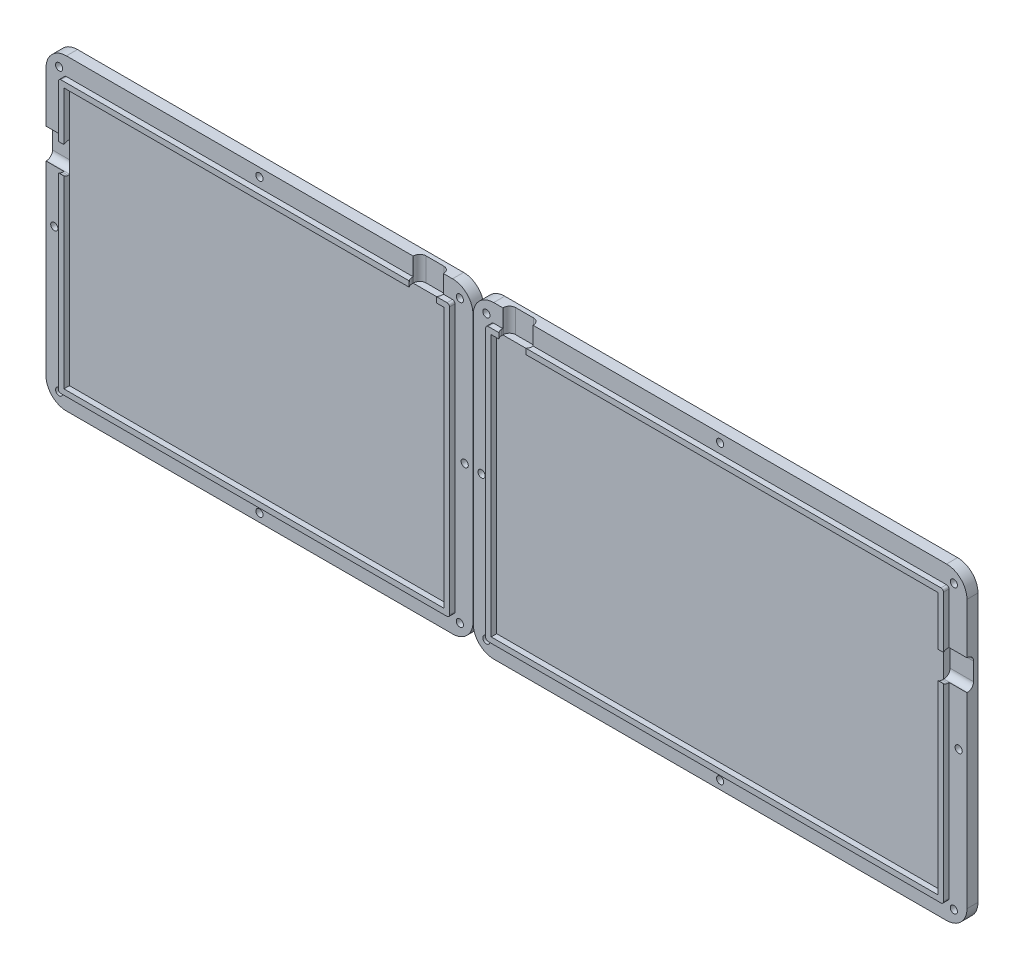
from build123d import *

# Parameters (mm, degrees)
BOSS_EXTRUDE1_DEPTH            = 2
BOSS_EXTRUDE1_2_DEPTH          = 2
BOSS_EXTRUDE2_DEPTH            = 4
BOSS_EXTRUDE2_2_DEPTH          = 4
CUT_EXTRUDE1_DEPTH             = 8.5
CUT_EXTRUDE2_START             = -8
CUT_EXTRUDE2_DEPTH             = 3.00475
CUT_EXTRUDE2_START_2           = -6.99525
CUT_EXTRUDE2_2_DEPTH           = 8.5
CUT_EXTRUDE3_START             = -7
CUT_EXTRUDE3_DEPTH             = 2
CUT_EXTRUDE3_START_2           = -24.24
CUT_EXTRUDE3_2_OUTLINE_W       = 2
CUT_EXTRUDE3_2_OUTLINE_H       = 2
CUT_EXTRUDE3_2_DEPTH           = 18.339999648
CUT_EXTRUDE3_START_3           = -2
CUT_EXTRUDE3_3_DEPTH           = 2
CUT_EXTRUDE3_START_4           = -14.39
CUT_EXTRUDE3_4_DEPTH           = 2
CUT_EXTRUDE3_START_5           = -24.799652403
CUT_EXTRUDE3_5_DEPTH           = 19.799652403
CUT_EXTRUDE3_6_DEPTH           = 2
CUT_EXTRUDE3_7_OUTLINE_W       = 2
CUT_EXTRUDE3_7_OUTLINE_H       = 2
CUT_EXTRUDE3_7_DEPTH           = 18.340003062
CUT_EXTRUDE3_8_DEPTH           = 2
CUT_EXTRUDE3_START_6           = 304.23
CUT_EXTRUDE3_9_DEPTH           = 2
CUT_EXTRUDE3_10_DEPTH          = 9
CUT_EXTRUDE3_11_DEPTH          = 19.799652403
CUT_EXTRUDE3_12_DEPTH          = 9
SKETCH7_R                      = 6
SKETCH7_R_2                    = 5.999999998
CUT_EXTRUDE4_DEPTH             = 1
CBORE_FOR_M2_SHCS1_AT_2_COUNT  = 2
CBORE_FOR_M2_SHCS1_AT_2_PITCH  = 169.33925
CBORE_FOR_M2_SHCS1_AT_3_COUNT  = 2
CBORE_FOR_M2_SHCS1_AT_3_PITCH  = 197.865862853
CBORE_FOR_M2_SHCS1_AT_4_COUNT  = 2
CBORE_FOR_M2_SHCS1_AT_4_PITCH  = 102.347999613
CBORE_FOR_M2_SHCS1_AT_5_COUNT  = 2
CBORE_FOR_M2_SHCS1_AT_5_PITCH  = 205.937809117
CBORE_FOR_M2_SHCS1_AT_6_COUNT  = 2
CBORE_FOR_M2_SHCS1_AT_6_PITCH  = 178.95
CBORE_FOR_M2_SHCS1_AT_7_COUNT  = 2
CBORE_FOR_M2_SHCS1_AT_7_PITCH  = 324.12
CBORE_FOR_M2_SHCS1_AT_8_COUNT  = 2
CBORE_FOR_M2_SHCS1_AT_8_PITCH  = 339.76617419
CBORE_FOR_M2_SHCS1_AT_9_COUNT  = 2
CBORE_FOR_M2_SHCS1_AT_9_PITCH  = 84.687729438
CBORE_FOR_M2_SHCS1_AT_10_COUNT = 2
CBORE_FOR_M2_SHCS1_AT_10_PITCH = 178.578567038
CBORE_FOR_M2_SHCS1_AT_11_COUNT = 2
CBORE_FOR_M2_SHCS1_AT_11_PITCH = 272.060490423
CBORE_FOR_M2_SHCS1_AT_12_COUNT = 2
CBORE_FOR_M2_SHCS1_AT_12_PITCH = 251.541084119
CBORE_FOR_M2_SHCS1_AT_13_COUNT = 2
CBORE_FOR_M2_SHCS1_AT_13_PITCH = 329.830375377
CBORE_FOR_M2_SHCS1_AT_14_COUNT = 2
CBORE_FOR_M2_SHCS1_AT_14_PITCH = 51.203914572
CBORE_FOR_M2_SHCS1_AT_15_COUNT = 2
CBORE_FOR_M2_SHCS1_AT_15_PITCH = 134.183962365
CBORE_FOR_M2_SHCS1_AT_16_COUNT = 2
CBORE_FOR_M2_SHCS1_AT_16_PITCH = 184.381831212


with BuildPart() as part:
    # Sketch2 → Boss-Extrude1 (new body)
    with BuildSketch(Plane(origin=(0, 0, 0), x_dir=(-1, 0, 0), z_dir=(0, 0, -1))):
        with BuildLine():
            Line((-127.28, 95.544999648), (-127.28, -1.072999648))
            ThreePointArc((-127.28, -1.072999648), (-127.016396, -1.709396), (-126.379999648, -1.973))
            Line((-126.379999648, -1.973), (13.489999648, -1.973))
            ThreePointArc((13.489999648, -1.973), (14.126396, -1.709396), (14.39, -1.072999648))
            Line((14.39, -1.072999648), (14.39, 65.764999333))
            Line((14.39, 65.764999333), (14.39, 77.705000667))
            Line((14.39, 77.705000667), (14.39, 95.544999648))
            ThreePointArc((14.39, 95.544999648), (14.126396, 96.181396), (13.489999648, 96.445))
            Line((13.489999648, 96.445), (-111.589999333, 96.445))
            Line((-111.589999333, 96.445), (-123.590000667, 96.445))
            Line((-123.590000667, 96.445), (-126.379999648, 96.445))
            ThreePointArc((-126.379999648, 96.445), (-127.016396, 96.181396), (-127.28, 95.544999648))
        make_face()
        Polygon((-125.28, 94.445), (-125.28, 0.027), (12.39, 0.027), (12.39, 65.764999333), (12.39, 77.705000667), (12.39, 94.445), (-111.589999333, 94.445), (-123.590000667, 94.445), align=None, mode=Mode.SUBTRACT)
    extrude(amount=BOSS_EXTRUDE1_DEPTH)

    # Cut-Extrude2: read off the stored shape, not the designer's step
    # Cut-Extrude2 outline → Cut-Extrude2 (cut)
    with BuildSketch(Plane.ZY.offset(19.38525).offset(CUT_EXTRUDE2_START)):
        with BuildLine():
            Line((-2, 77.205), (-2, 66.265))
            Line((-2, 66.265), (-1.485, 66.265))
            ThreePointArc((-1.485, 66.265), (-0.691520981, 66.409556805), (0, 66.824652403))
            Line((0, 66.824652403), (0, 76.645347597))
            ThreePointArc((0, 76.645347597), (-0.691520981, 77.060443195), (-1.485, 77.205))
            Line((-1.485, 77.205), (-2, 77.205))
        make_face()
    extrude(amount=CUT_EXTRUDE2_DEPTH, mode=Mode.SUBTRACT)

    # Cut-Extrude3 11 outline → Cut-Extrude3 11 (cut)
    with BuildSketch(Plane(origin=(0, 101.445, 0), x_dir=(1, 0, 0), z_dir=(0, 1, 0)).offset(CUT_EXTRUDE3_START_5)):
        with BuildLine():
            ThreePointArc((122.500347597, 0), (122.915443195, 0.691520981), (123.06, 1.485))
            Line((123.06, 1.485), (123.06, 2))
            Line((123.06, 2), (-14.39, 2))
            Line((-14.39, 2), (-14.39, 0))
            Line((-14.39, 0), (122.500347597, 0))
        make_face()
    extrude(amount=CUT_EXTRUDE3_11_DEPTH, mode=Mode.SUBTRACT)


with BuildPart() as body_2:
    # Sketch2 → Boss-Extrude1 2 (new body)
    with BuildSketch(Plane(origin=(0, 0, 0), x_dir=(-1, 0, 0), z_dir=(0, 0, -1))):
        with BuildLine():
            Line((-156.080000667, 96.445), (-305.330002531, 96.445))
            ThreePointArc((-305.330002531, 96.445), (-305.966396812, 96.181397188), (-306.23, 95.545003062))
            Line((-306.23, 95.545003062), (-306.23, 77.705000667))
            Line((-306.23, 77.705000667), (-306.23, 65.764999333))
            Line((-306.23, 65.764999333), (-306.23, -1.503002531))
            ThreePointArc((-306.23, -1.503002531), (-305.966397047, -2.139396422), (-305.330003194, -2.402999469))
            Line((-305.330003194, -2.402999469), (-141.290563258, -2.403023469))
            ThreePointArc((-141.290563258, -2.403023469), (-140.654299585, -2.139474508), (-140.390750531, -1.503210874))
            Line((-140.390750531, -1.503210874), (-140.390750531, 95.545003062))
            ThreePointArc((-140.390750531, 95.545003062), (-140.654353531, 96.181397), (-141.290747469, 96.445))
            Line((-141.290747469, 96.445), (-144.079999333, 96.445))
            Line((-144.079999333, 96.445), (-156.080000667, 96.445))
        make_face()
        Polygon((-156.080000667, 94.445), (-304.23, 94.445), (-304.23, 77.705000667), (-304.23, 65.764999333), (-304.23, -0.40299963), (-142.390750531, -0.403023308), (-142.390750531, 94.445), (-144.079999333, 94.445), align=None, mode=Mode.SUBTRACT)
    extrude(amount=BOSS_EXTRUDE1_2_DEPTH)


with BuildPart() as body_3:
    # Sketch3 → Boss-Extrude2 (new body)
    with BuildSketch(Plane(origin=(0, 0, -2), x_dir=(-1, 0, 0), z_dir=(0, 0, -1))):
        with BuildLine():
            Line((-141.290751305, 102.945), (-144.079999333, 102.945))
            Line((-144.079999333, 102.945), (-305.330002531, 102.945))
            ThreePointArc((-305.330002531, 102.945), (-310.562592434, 100.777589721), (-312.73, 95.544998695))
            Line((-312.73, 95.544998695), (-312.73, -1.503002531))
            ThreePointArc((-312.73, -1.503002531), (-310.562589913, -6.735592243), (-305.329999236, -8.903))
            Line((-305.329999236, -8.903), (-141.291035381, -8.903023979))
            ThreePointArc((-141.291035381, -8.903023979), (-136.05806597, -6.735630109), (-133.890750032, -1.502628421))
            Line((-133.890750032, -1.502628421), (-133.89075, 95.544998695))
            ThreePointArc((-133.89075, 95.544998695), (-136.058158922, 100.777591078), (-141.290751305, 102.945))
        make_face()
    extrude(amount=BOSS_EXTRUDE2_DEPTH)


with BuildPart() as body_4:
    # Sketch3 → Boss-Extrude2 2 (new body)
    with BuildSketch(Plane(origin=(0, 0, -2), x_dir=(-1, 0, 0), z_dir=(0, 0, -1))):
        with BuildLine():
            Line((-133.78, 95.545000824), (-133.78, -1.073000824))
            ThreePointArc((-133.78, -1.073000824), (-131.612590078, -6.305590078), (-126.380000824, -8.473))
            Line((-126.380000824, -8.473), (13.490009317, -8.473))
            ThreePointArc((13.490009317, -8.473), (18.722593496, -6.305586659), (20.89, -1.072999648))
            Line((20.89, -1.072999648), (20.89, 95.545009317))
            ThreePointArc((20.89, 95.545009317), (18.722587075, 100.77759308), (13.490000824, 102.945))
            Line((13.490000824, 102.945), (-123.590000667, 102.945))
            Line((-123.590000667, 102.945), (-126.380009317, 102.945))
            ThreePointArc((-126.380009317, 102.945), (-131.61259308, 100.777587075), (-133.78, 95.545000824))
        make_face()
    extrude(amount=BOSS_EXTRUDE2_2_DEPTH)

    # Cut-Extrude2 2 outline → Cut-Extrude2 2 (cut)
    with BuildSketch(Plane.ZY.offset(19.38525).offset(CUT_EXTRUDE2_START_2)):
        with BuildLine():
            Line((-2, 66.265), (-2, 77.205))
            Line((-2, 77.205), (-2.145, 77.205))
            ThreePointArc((-2.145, 77.205), (-3.735990258, 76.545990258), (-4.395, 74.955))
            Line((-4.395, 74.955), (-4.395, 68.515))
            ThreePointArc((-4.395, 68.515), (-3.735990258, 66.924009742), (-2.145, 66.265))
            Line((-2.145, 66.265), (-2, 66.265))
        make_face()
    extrude(amount=CUT_EXTRUDE2_2_DEPTH, mode=Mode.SUBTRACT)

    # Cut-Extrude3 12 outline → Cut-Extrude3 12 (cut)
    with BuildSketch(Plane(origin=(0, 101.445, 0), x_dir=(1, 0, 0), z_dir=(0, 1, 0)).offset(CUT_EXTRUDE3_START)):
        with BuildLine():
            ThreePointArc((123.06, 2.145), (122.400990258, 3.735990258), (120.81, 4.395))
            Line((120.81, 4.395), (114.37, 4.395))
            ThreePointArc((114.37, 4.395), (112.779009742, 3.735990258), (112.12, 2.145))
            Line((112.12, 2.145), (112.12, 2))
            Line((112.12, 2), (123.06, 2))
            Line((123.06, 2), (123.06, 2.145))
        make_face()
    extrude(amount=CUT_EXTRUDE3_12_DEPTH, mode=Mode.SUBTRACT)


with BuildPart() as cut_extrude1_tool:
    # Sketch4 → Cut-Extrude1 (new body)
    with BuildSketch(Plane(origin=(312.73, 0, 0), x_dir=(0, 0, -1), z_dir=(1, 0, 0))):
        with BuildLine():
            Line((1.485, 66.265), (2, 66.265))
            Line((2, 66.265), (2, 77.205))
            Line((2, 77.205), (1.485, 77.205))
            ThreePointArc((1.485, 77.205), (-0.105990258, 76.545990258), (-0.765, 74.955))
            Line((-0.765, 74.955), (-0.765, 73.003244897))
            Line((-0.765, 73.003244897), (-0.765, 71.023244897))
            Line((-0.765, 71.023244897), (-0.765, 68.515))
            ThreePointArc((-0.765, 68.515), (-0.105990258, 66.924009742), (1.485, 66.265))
        make_face()
        with BuildLine():
            ThreePointArc((2.145, 66.265), (3.735990258, 66.924009742), (4.395, 68.515))
            Line((4.395, 68.515), (4.395, 74.955))
            ThreePointArc((4.395, 74.955), (3.735990258, 76.545990258), (2.145, 77.205))
            Line((2.145, 77.205), (2, 77.205))
            Line((2, 77.205), (2, 66.265))
            Line((2, 66.265), (2.145, 66.265))
        make_face()
    extrude(amount=-CUT_EXTRUDE1_DEPTH)


with BuildPart() as body_2_1:
    add(body_2.part)

    # Cut-Extrude1: cut by cut_extrude1_tool
    add(cut_extrude1_tool.part, mode=Mode.SUBTRACT)

    # Cut-Extrude3 5 outline → Cut-Extrude3 5 (cut)
    with BuildSketch(Plane(origin=(0, 101.445, 0), x_dir=(1, 0, 0), z_dir=(0, 1, 0)).offset(CUT_EXTRUDE3_START_5)):
        with BuildLine():
            Line((144.61, 2), (144.61, 1.485))
            ThreePointArc((144.61, 1.485), (144.754556805, 0.691520981), (145.169652403, 0))
            Line((145.169652403, 0), (306.23, 0))
            Line((306.23, 0), (306.23, 2))
            Line((306.23, 2), (144.61, 2))
        make_face()
    extrude(amount=CUT_EXTRUDE3_5_DEPTH, mode=Mode.SUBTRACT)


with BuildPart() as body_3_1:
    add(body_3.part)

    # Cut-Extrude1: cut by cut_extrude1_tool
    add(cut_extrude1_tool.part, mode=Mode.SUBTRACT)

    # Cut-Extrude3 10 outline → Cut-Extrude3 10 (cut)
    with BuildSketch(Plane(origin=(0, 101.445, 0), x_dir=(1, 0, 0), z_dir=(0, 1, 0)).offset(CUT_EXTRUDE3_START)):
        with BuildLine():
            ThreePointArc((155.55, 2.145), (154.890990258, 3.735990258), (153.3, 4.395))
            Line((153.3, 4.395), (146.86, 4.395))
            ThreePointArc((146.86, 4.395), (145.269009742, 3.735990258), (144.61, 2.145))
            Line((144.61, 2.145), (144.61, 2))
            Line((144.61, 2), (155.55, 2))
            Line((155.55, 2), (155.55, 2.145))
        make_face()
    extrude(amount=CUT_EXTRUDE3_10_DEPTH, mode=Mode.SUBTRACT)


with BuildPart() as body_5:
    # Cut-Extrude3: read off the stored shape, not the designer's step
    # Cut-Extrude3 outline → Cut-Extrude3 (new body)
    with BuildSketch(Plane(origin=(0, 101.445, 0), x_dir=(1, 0, 0), z_dir=(0, 1, 0)).offset(CUT_EXTRUDE3_START)):
        with BuildLine():
            Line((-12.39, 0), (112.679652403, 0))
            ThreePointArc((112.679652403, 0), (112.264556805, 0.691520981), (112.12, 1.485))
            Line((112.12, 1.485), (112.12, 2))
            Line((112.12, 2), (-12.39, 2))
            Line((-12.39, 2), (-12.39, 0))
        make_face()
    extrude(amount=CUT_EXTRUDE3_DEPTH)

    # Cut-Extrude3 2 outline → Cut-Extrude3 2 (add)
    with BuildSketch(Plane(origin=(0, 101.445, 0), x_dir=(1, 0, 0), z_dir=(0, 1, 0)).offset(CUT_EXTRUDE3_START_2)):
        with Locations((-13.39, 1)):
            Rectangle(CUT_EXTRUDE3_2_OUTLINE_W, CUT_EXTRUDE3_2_OUTLINE_H)
    extrude(amount=CUT_EXTRUDE3_2_DEPTH)

    # Cut-Extrude3 3 outline → Cut-Extrude3 3 (add)
    with BuildSketch(Plane.XY.offset(CUT_EXTRUDE3_START_3)):
        with BuildLine():
            Line((-12.39, 96.445), (-13.489999648, 96.445))
            ThreePointArc((-13.489999648, 96.445), (-14.126396, 96.181396), (-14.39, 95.544999648))
            Line((-14.39, 95.544999648), (-12.39, 95.544999648))
            Line((-12.39, 95.544999648), (-12.39, 96.445))
        make_face()
    extrude(amount=CUT_EXTRUDE3_3_DEPTH)

    # Cut-Extrude3 4 outline → Cut-Extrude3 4 (add)
    with BuildSketch(Plane.YZ.offset(CUT_EXTRUDE3_START_4)):
        with BuildLine():
            Line((77.205, 0), (76.645347597, 0))
            ThreePointArc((76.645347597, 0), (77.060443195, -0.691520981), (77.205, -1.485))
            Line((77.205, -1.485), (77.205, 0))
        make_face()
    extrude(amount=CUT_EXTRUDE3_4_DEPTH)


with BuildPart() as body_6:
    # Cut-Extrude3 6 outline → Cut-Extrude3 6 (new body)
    with BuildSketch(Plane(origin=(0, 101.445, 0), x_dir=(1, 0, 0), z_dir=(0, 1, 0)).offset(CUT_EXTRUDE3_START)):
        with BuildLine():
            Line((154.990347597, 0), (304.23, 0))
            Line((304.23, 0), (304.23, 2))
            Line((304.23, 2), (155.55, 2))
            Line((155.55, 2), (155.55, 1.485))
            ThreePointArc((155.55, 1.485), (155.405443195, 0.691520981), (154.990347597, 0))
        make_face()
    extrude(amount=CUT_EXTRUDE3_6_DEPTH)

    # Cut-Extrude3 7 outline → Cut-Extrude3 7 (add)
    with BuildSketch(Plane(origin=(0, 101.445, 0), x_dir=(1, 0, 0), z_dir=(0, 1, 0)).offset(CUT_EXTRUDE3_START_2)):
        with Locations((305.23, 1)):
            Rectangle(CUT_EXTRUDE3_7_OUTLINE_W, CUT_EXTRUDE3_7_OUTLINE_H)
    extrude(amount=CUT_EXTRUDE3_7_DEPTH)

    # Cut-Extrude3 8 outline → Cut-Extrude3 8 (add)
    with BuildSketch(Plane.XY.offset(CUT_EXTRUDE3_START_3)):
        with BuildLine():
            Line((304.23, 95.545003062), (306.23, 95.545003062))
            ThreePointArc((306.23, 95.545003062), (305.966396812, 96.181397188), (305.330002531, 96.445))
            Line((305.330002531, 96.445), (304.23, 96.445))
            Line((304.23, 96.445), (304.23, 95.545003062))
        make_face()
    extrude(amount=CUT_EXTRUDE3_8_DEPTH)

    # Cut-Extrude3 9 outline → Cut-Extrude3 9 (add)
    with BuildSketch(Plane.YZ.offset(CUT_EXTRUDE3_START_6)):
        with BuildLine():
            ThreePointArc((76.645347597, 0), (77.060443195, -0.691520981), (77.205, -1.485))
            Line((77.205, -1.485), (77.205, 0))
            Line((77.205, 0), (76.645347597, 0))
        make_face()
    extrude(amount=CUT_EXTRUDE3_9_DEPTH)


with BuildPart() as cut_extrude4_tool:
    # Sketch7 → Cut-Extrude4 (new body)
    with BuildSketch(Plane(origin=(0, 0, -6), x_dir=(-1, 0, 0), z_dir=(0, 0, -1))):
        with Locations((8.89, 90.945)):
            Circle(SKETCH7_R)
        with Locations((8.89, 3.527)):
            Circle(SKETCH7_R)
        with Locations((-121.78, 90.945)):
            Circle(SKETCH7_R)
        with Locations((-121.78, 3.527)):
            Circle(SKETCH7_R)
        with Locations((-145.89075, 90.945)):
            Circle(SKETCH7_R_2)
        with Locations((-145.89075, 3.096976693)):
            Circle(SKETCH7_R)
        with Locations((-300.73, 90.945)):
            Circle(SKETCH7_R)
        with Locations((-300.73, 3.096999328)):
            Circle(SKETCH7_R)
        with Locations((-223.31039198, 90.945)):
            Circle(SKETCH7_R_2)
        with Locations((-223.310502246, 3.096988011)):
            Circle(SKETCH7_R_2)
        with Locations((-56.444995753, 90.945)):
            Circle(SKETCH7_R)
        with Locations((-56.444995753, 3.527)):
            Circle(SKETCH7_R)
    extrude(amount=-CUT_EXTRUDE4_DEPTH)


with BuildPart() as body_3_2:
    add(body_3_1.part)

    # Cut-Extrude4: cut by cut_extrude4_tool
    add(cut_extrude4_tool.part, mode=Mode.SUBTRACT)

    # Sketch9 → CBORE for M2 SHCS1 (revolve, cut)
    with BuildSketch(Plane(origin=(307.98, 98.195, -6), x_dir=(0, 1, 0), z_dir=(1, 0, 0))):
        Polygon((0, 0), (0, 8), (1.3, 7.218881195), (1.3, 2), (2.2, 2), (2.2, 0), align=None)
    cbore_for_m2_shcs1 = revolve(axis=Axis((307.98, 98.195, -12.35), (0, 0, 1)), mode=Mode.SUBTRACT)

    # CBORE for M2 SHCS1 at 2: CBORE for M2 SHCS1 ×2
    with Locations(*[(-i * CBORE_FOR_M2_SHCS1_AT_2_PITCH, 0, 0) for i in range(1, CBORE_FOR_M2_SHCS1_AT_2_COUNT)]):
        add(cbore_for_m2_shcs1, mode=Mode.SUBTRACT)

    # CBORE for M2 SHCS1 at 3: CBORE for M2 SHCS1 ×2
    with Locations(*[Vector(-0.8558285272557075, -0.5172596368704278, 0) * (i * CBORE_FOR_M2_SHCS1_AT_3_PITCH) for i in range(1, CBORE_FOR_M2_SHCS1_AT_3_COUNT)]):
        add(cbore_for_m2_shcs1, mode=Mode.SUBTRACT)

    # CBORE for M2 SHCS1 at 4: CBORE for M2 SHCS1 ×2
    with Locations(*[(0, -i * CBORE_FOR_M2_SHCS1_AT_4_PITCH, 0) for i in range(1, CBORE_FOR_M2_SHCS1_AT_4_COUNT)]):
        add(cbore_for_m2_shcs1, mode=Mode.SUBTRACT)

    # CBORE for M2 SHCS1 at 9: CBORE for M2 SHCS1 ×2
    with Locations(*[Vector(-0.9997864736420369, 0.020664150658107016, 0) * (i * CBORE_FOR_M2_SHCS1_AT_9_PITCH) for i in range(1, CBORE_FOR_M2_SHCS1_AT_9_COUNT)]):
        add(cbore_for_m2_shcs1, mode=Mode.SUBTRACT)

    # CBORE for M2 SHCS1 at 10: CBORE for M2 SHCS1 ×2
    with Locations(*[Vector(-0.9580615010974515, -0.28656266350468296, 0) * (i * CBORE_FOR_M2_SHCS1_AT_10_PITCH) for i in range(1, CBORE_FOR_M2_SHCS1_AT_10_COUNT)]):
        add(cbore_for_m2_shcs1, mode=Mode.SUBTRACT)

    # CBORE for M2 SHCS1 at 14: CBORE for M2 SHCS1 ×2
    with Locations(*[Vector(0.0341770744412766, -0.9994157931424915, 0) * (i * CBORE_FOR_M2_SHCS1_AT_14_PITCH) for i in range(1, CBORE_FOR_M2_SHCS1_AT_14_COUNT)]):
        add(cbore_for_m2_shcs1, mode=Mode.SUBTRACT)

    # CBORE for M2 SHCS1 at 15: CBORE for M2 SHCS1 ×2
    with Locations(*[Vector(-0.630996354561663, -0.7757857955195443, 0) * (i * CBORE_FOR_M2_SHCS1_AT_15_PITCH) for i in range(1, CBORE_FOR_M2_SHCS1_AT_15_COUNT)]):
        add(cbore_for_m2_shcs1, mode=Mode.SUBTRACT)

    # Combine2: union body 6
    add(body_6.part)


with BuildPart() as body_4_1:
    add(body_4.part)

    # Cut-Extrude4: cut by cut_extrude4_tool
    add(cut_extrude4_tool.part, mode=Mode.SUBTRACT)

    # CBORE for M2 SHCS1 at 5: CBORE for M2 SHCS1 ×2
    with Locations(*[Vector(-0.8689516547111612, -0.49489698097153, 0) * (i * CBORE_FOR_M2_SHCS1_AT_5_PITCH) for i in range(1, CBORE_FOR_M2_SHCS1_AT_5_COUNT)]):
        add(cbore_for_m2_shcs1, mode=Mode.SUBTRACT)

    # CBORE for M2 SHCS1 at 6: CBORE for M2 SHCS1 ×2
    with Locations(*[(-i * CBORE_FOR_M2_SHCS1_AT_6_PITCH, 0, 0) for i in range(1, CBORE_FOR_M2_SHCS1_AT_6_COUNT)]):
        add(cbore_for_m2_shcs1, mode=Mode.SUBTRACT)

    # CBORE for M2 SHCS1 at 7: CBORE for M2 SHCS1 ×2
    with Locations(*[(-i * CBORE_FOR_M2_SHCS1_AT_7_PITCH, 0, 0) for i in range(1, CBORE_FOR_M2_SHCS1_AT_7_COUNT)]):
        add(cbore_for_m2_shcs1, mode=Mode.SUBTRACT)

    # CBORE for M2 SHCS1 at 8: CBORE for M2 SHCS1 ×2
    with Locations(*[Vector(-0.9539501710913034, -0.29996511643001583, 0) * (i * CBORE_FOR_M2_SHCS1_AT_8_PITCH) for i in range(1, CBORE_FOR_M2_SHCS1_AT_8_COUNT)]):
        add(cbore_for_m2_shcs1, mode=Mode.SUBTRACT)

    # CBORE for M2 SHCS1 at 11: CBORE for M2 SHCS1 ×2
    with Locations(*[Vector(-0.9245554163680936, -0.3810476112829227, 0) * (i * CBORE_FOR_M2_SHCS1_AT_11_PITCH) for i in range(1, CBORE_FOR_M2_SHCS1_AT_11_COUNT)]):
        add(cbore_for_m2_shcs1, mode=Mode.SUBTRACT)

    # CBORE for M2 SHCS1 at 12: CBORE for M2 SHCS1 ×2
    with Locations(*[Vector(-0.9999757989894932, 0.006957114008331568, 0) * (i * CBORE_FOR_M2_SHCS1_AT_12_PITCH) for i in range(1, CBORE_FOR_M2_SHCS1_AT_12_COUNT)]):
        add(cbore_for_m2_shcs1, mode=Mode.SUBTRACT)

    # CBORE for M2 SHCS1 at 13: CBORE for M2 SHCS1 ×2
    with Locations(*[Vector(-0.9879926905698493, -0.15450062582575524, 0) * (i * CBORE_FOR_M2_SHCS1_AT_13_PITCH) for i in range(1, CBORE_FOR_M2_SHCS1_AT_13_COUNT)]):
        add(cbore_for_m2_shcs1, mode=Mode.SUBTRACT)

    # CBORE for M2 SHCS1 at 16: CBORE for M2 SHCS1 ×2
    with Locations(*[Vector(-0.9610491382770345, -0.27637755664483604, 0) * (i * CBORE_FOR_M2_SHCS1_AT_16_PITCH) for i in range(1, CBORE_FOR_M2_SHCS1_AT_16_COUNT)]):
        add(cbore_for_m2_shcs1, mode=Mode.SUBTRACT)

    # Combine1: union part
    add(part.part)


solid = Compound([body_2_1.part, body_5.part, body_3_2.part, body_4_1.part])
